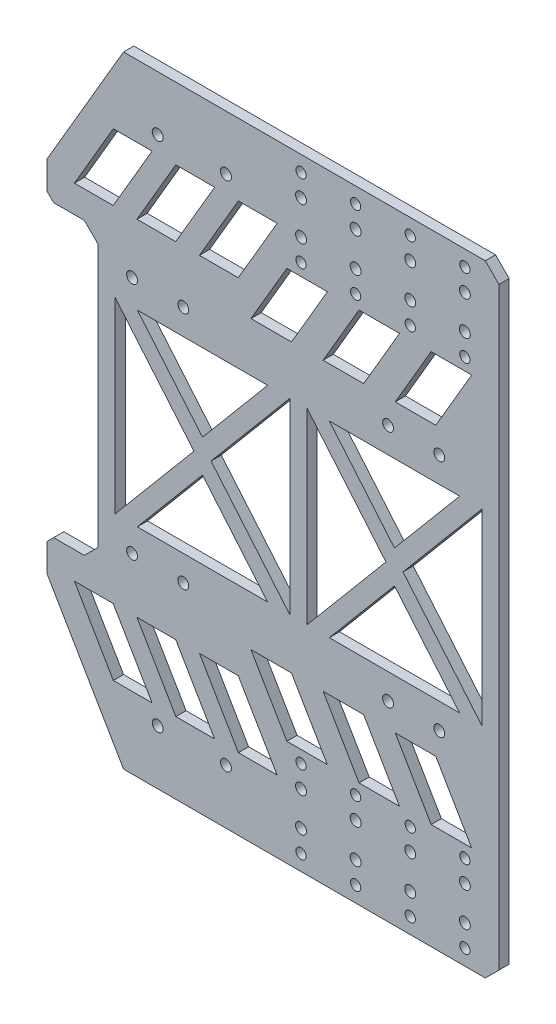
from build123d import *

# Parameters (mm, degrees)
SKETCH_1_W           = 198
SKETCH_1_H           = 182
EXTRUDE_1_DEPTH      = 3
SKETCH_3_R           = 1.6
CUT_EXTRUDE_2_DEPTH  = 3
CUT_EXTRUDE_3_REACH  = 136.503
SKETCH_4_W           = 48
SKETCH_4_H           = 182
SKETCH_5_W           = 40.08977314
SKETCH_5_H           = 112
EXTRUDE_2_DEPTH      = 3
CUT_EXTRUDE_4_REACH  = 168.203
SKETCH_6_R           = 2.75
CUT_EXTRUDE_5_REACH  = 168.203
EXTRUDE_3_DEPTH      = 3
SKETCH_10_R          = 5
CUT_EXTRUDE_6_DEPTH  = 10
SKETCH_11_W          = 64.5
SKETCH_11_H          = 5
SKETCH_11_W_2        = 5
SKETCH_11_H_2        = 27.5973386
SKETCH_11_W_3        = 27.979591052
SKETCH_11_W_4        = 25.900597597
EXTRUDE_1_2_DEPTH    = 3
SKETCH_12_W          = 5
SKETCH_12_H          = 27.589725495
SKETCH_12_H_2        = 28.751885351
SKETCH_12_H_3        = 68.5
EXTRUDE_2_2_DEPTH    = 3
EXTRUDE_3_2_DEPTH    = 3
EXTRUDE_4_DEPTH      = 3
CUT_EXTRUDE_7_REACH  = 168.203
SKETCH_15_R          = 2.75
EXTRUDE_5_DEPTH      = 3
EXTRUDE_6_DEPTH      = 3
CUT_EXTRUDE_8_REACH  = 168.203
SKETCH_18_R          = 2.75
EXTRUDE_7_DEPTH      = 3
CUT_EXTRUDE_9_REACH  = 168.203
SKETCH_20_R          = 2.75
EXTRUDE_8_DEPTH      = 3
CUT_EXTRUDE_10_REACH = 168.203
SKETCH_22_R          = 2.75
EXTRUDE_4_2_DEPTH    = 3
SKETCH_24_W          = 34.702091236
SKETCH_24_H          = 10
EXTRUDE_9_DEPTH      = 3
CUT_EXTRUDE_11_REACH = 168.203
CUT_EXTRUDE_12_REACH = 168.203
SKETCH_26_R          = 2.75
EXTRUDE_5_2_DEPTH    = 3
SKETCH_28_W          = 250
SKETCH_28_H          = 182
SKETCH_28_R          = 1.6
EXTRUDE_6_2_DEPTH    = 3
SKETCH_29_R          = 1.6
CUT_EXTRUDE_13_DEPTH = 219.840124292
SKETCH_30_R          = 1.6
CUT_EXTRUDE_14_DEPTH = 219.840124292
SKETCH_31_OUTSIDE_W  = 313.85
SKETCH_31_OUTSIDE_H  = 245.85
CUT_EXTRUDE_15_DEPTH = 219.840124292
CUT_EXTRUDE_16_DEPTH = 186.397545831
CHAMFER_1_SIZE       = 2
CHAMFER_2_SIZE       = 4
SKETCH_34_R          = 1.5
CUT_EXTRUDE_17_DEPTH = 186.397545831


with BuildPart() as part:
    # 草图1 → Extrude 1 (new body)
    with BuildSketch(Plane.XY):
        Rectangle(SKETCH_1_W, SKETCH_1_H)
    extrude(amount=EXTRUDE_1_DEPTH)

    # 草图3 → 切除-拉伸2 (cut)
    with BuildSketch(Plane(origin=(0, 0, 0), x_dir=(-1, 0, 0), z_dir=(0, 0, -1))):
        with Locations((-39, -80)):
            Circle(SKETCH_3_R)
        with Locations((-39, -70)):
            Circle(SKETCH_3_R)
        with Locations((-23, -80)):
            Circle(SKETCH_3_R)
        with Locations((-23, -70)):
            Circle(SKETCH_3_R)
        with Locations((-7, -80)):
            Circle(SKETCH_3_R)
        with Locations((-7, -70)):
            Circle(SKETCH_3_R)
        with Locations((9, -80)):
            Circle(SKETCH_3_R)
        with Locations((9, -70)):
            Circle(SKETCH_3_R)
        with Locations((87, -80)):
            Circle(SKETCH_3_R)
        with Locations((87, -70)):
            Circle(SKETCH_3_R)
        with Locations((71, -80)):
            Circle(SKETCH_3_R)
        with Locations((71, -70)):
            Circle(SKETCH_3_R)
        with Locations((55, -80)):
            Circle(SKETCH_3_R)
        with Locations((55, -70)):
            Circle(SKETCH_3_R)
        with Locations((39, -80)):
            Circle(SKETCH_3_R)
        with Locations((39, -70)):
            Circle(SKETCH_3_R)
        with Locations((39, 70)):
            Circle(SKETCH_3_R)
        with Locations((39, 80)):
            Circle(SKETCH_3_R)
        with Locations((55, 70)):
            Circle(SKETCH_3_R)
        with Locations((55, 80)):
            Circle(SKETCH_3_R)
        with Locations((71, 70)):
            Circle(SKETCH_3_R)
        with Locations((71, 80)):
            Circle(SKETCH_3_R)
        with Locations((87, 70)):
            Circle(SKETCH_3_R)
        with Locations((87, 80)):
            Circle(SKETCH_3_R)
        with Locations((9, 70)):
            Circle(SKETCH_3_R)
        with Locations((9, 80)):
            Circle(SKETCH_3_R)
        with Locations((-7, 70)):
            Circle(SKETCH_3_R)
        with Locations((-7, 80)):
            Circle(SKETCH_3_R)
        with Locations((-23, 70)):
            Circle(SKETCH_3_R)
        with Locations((-23, 80)):
            Circle(SKETCH_3_R)
        with Locations((-39, 70)):
            Circle(SKETCH_3_R)
        with Locations((-39, 80)):
            Circle(SKETCH_3_R)
    extrude(amount=-CUT_EXTRUDE_2_DEPTH, mode=Mode.SUBTRACT)

    # 草图4 → 切除-拉伸3 (cut, up to next)
    with BuildSketch(Plane(origin=(0, 0, 0), x_dir=(-1, 0, 0), z_dir=(0, 0, -1)), mode=Mode.PRIVATE) as cut_extrude_3_sk1:
        with Locations((-75, 0)):
            Rectangle(SKETCH_4_W, SKETCH_4_H)
    cut_extrude_3_tool1 = extrude(cut_extrude_3_sk1.sketch, amount=-CUT_EXTRUDE_3_REACH, mode=Mode.PRIVATE) & part.part
    add(cut_extrude_3_tool1.solids().sort_by_distance((75, 0, 0))[0], mode=Mode.SUBTRACT)

    # 草图5 → Extrude 2 (add)
    with BuildSketch(Plane.XY.offset(3)):
        with Locations((-119, 0)):
            Rectangle(SKETCH_5_W, SKETCH_5_H)
    extrude(amount=-EXTRUDE_2_DEPTH)

    # 草图6 → 切除-拉伸4 (cut, up to next)
    with BuildSketch(Plane.XY.offset(3), mode=Mode.PRIVATE) as cut_extrude_4_sk1:
        with Locations((13, -37)):
            Circle(SKETCH_6_R)
    cut_extrude_4_tool1 = extrude(cut_extrude_4_sk1.sketch, amount=-CUT_EXTRUDE_4_REACH, mode=Mode.PRIVATE) & part.part
    # 草图6 → 切除-拉伸4 (cut, up to next)
    with BuildSketch(Plane.XY.offset(3), mode=Mode.PRIVATE) as cut_extrude_4_sk2:
        with Locations((13, 37)):
            Circle(SKETCH_6_R)
    cut_extrude_4_tool2 = extrude(cut_extrude_4_sk2.sketch, amount=-CUT_EXTRUDE_4_REACH, mode=Mode.PRIVATE) & part.part
    # 草图6 → 切除-拉伸4 (cut, up to next)
    with BuildSketch(Plane.XY.offset(3), mode=Mode.PRIVATE) as cut_extrude_4_sk3:
        with Locations((-57, 37)):
            Circle(SKETCH_6_R)
    cut_extrude_4_tool3 = extrude(cut_extrude_4_sk3.sketch, amount=-CUT_EXTRUDE_4_REACH, mode=Mode.PRIVATE) & part.part
    # 草图6 → 切除-拉伸4 (cut, up to next)
    with BuildSketch(Plane.XY.offset(3), mode=Mode.PRIVATE) as cut_extrude_4_sk4:
        with Locations((-57, -37)):
            Circle(SKETCH_6_R)
    cut_extrude_4_tool4 = extrude(cut_extrude_4_sk4.sketch, amount=-CUT_EXTRUDE_4_REACH, mode=Mode.PRIVATE) & part.part
    # 草图6 → 切除-拉伸4 (cut, up to next)
    with BuildSketch(Plane.XY.offset(3), mode=Mode.PRIVATE) as cut_extrude_4_sk5:
        with Locations((-127, 37)):
            Circle(SKETCH_6_R)
    cut_extrude_4_tool5 = extrude(cut_extrude_4_sk5.sketch, amount=-CUT_EXTRUDE_4_REACH, mode=Mode.PRIVATE) & part.part
    # 草图6 → 切除-拉伸4 (cut, up to next)
    with BuildSketch(Plane.XY.offset(3), mode=Mode.PRIVATE) as cut_extrude_4_sk6:
        with Locations((-127, -37)):
            Circle(SKETCH_6_R)
    cut_extrude_4_tool6 = extrude(cut_extrude_4_sk6.sketch, amount=-CUT_EXTRUDE_4_REACH, mode=Mode.PRIVATE) & part.part
    add(cut_extrude_4_tool1.solids().sort_by_distance((13, -37, 3))[0], mode=Mode.SUBTRACT)
    add(cut_extrude_4_tool2.solids().sort_by_distance((13, 37, 3))[0], mode=Mode.SUBTRACT)
    add(cut_extrude_4_tool3.solids().sort_by_distance((-57, 37, 3))[0], mode=Mode.SUBTRACT)
    add(cut_extrude_4_tool4.solids().sort_by_distance((-57, -37, 3))[0], mode=Mode.SUBTRACT)
    add(cut_extrude_4_tool5.solids().sort_by_distance((-127, 37, 3))[0], mode=Mode.SUBTRACT)
    add(cut_extrude_4_tool6.solids().sort_by_distance((-127, -37, 3))[0], mode=Mode.SUBTRACT)

    # 草图7 → 切除-拉伸5 (cut, up to next)
    with BuildSketch(Plane.XY.offset(3), mode=Mode.PRIVATE) as cut_extrude_5_sk1:
        Polygon((-29.011221643, -15), (-19.011221643, -25), (25.988778357, -25), (35.988778357, -15), (35.988778357, 15), (25.988778357, 25), (-19.011221643, 25), (-29.011221643, 15), align=None)
    cut_extrude_5_tool1 = extrude(cut_extrude_5_sk1.sketch, amount=-CUT_EXTRUDE_5_REACH, mode=Mode.PRIVATE) & part.part
    # 草图7 → 切除-拉伸5 (cut, up to next)
    with BuildSketch(Plane.XY.offset(3), mode=Mode.PRIVATE) as cut_extrude_5_sk2:
        Polygon((-114.033664928, -25), (-124.033664928, -15), (-124.033664928, 15), (-114.033664928, 25), (-69.033664928, 25), (-59.033664928, 15), (-59.033664928, -15), (-69.033664928, -25), align=None)
    cut_extrude_5_tool2 = extrude(cut_extrude_5_sk2.sketch, amount=-CUT_EXTRUDE_5_REACH, mode=Mode.PRIVATE) & part.part
    add(cut_extrude_5_tool1.solids().sort_by_distance((3.488778, 0, 3))[0], mode=Mode.SUBTRACT)
    add(cut_extrude_5_tool2.solids().sort_by_distance((-91.533665, 0, 3))[0], mode=Mode.SUBTRACT)

    # 草图8 → Extrude 3 (add)
    with BuildSketch(Plane.XY.offset(3)):
        Polygon((-99, -56), (-139.04488657, -56), (-99, -91), align=None)
        Polygon((-139.04488657, 56), (-99, 91), (-99, 56), align=None)
    extrude(amount=-EXTRUDE_3_DEPTH)

    # 草图10 → 切除-拉伸6 (cut)
    # profile 1 of 2: a face of its own
    with BuildSketch(Plane.XY.offset(3)):
        with BuildLine():
            Line((-127, 32), (-127, 0))
            Line((-127, 0), (41, 0))
            Line((41, 0), (41, 66))
            Line((41, 66), (-115.251187, 66))
            Line((-115.251187, 66), (-127, 55.73131178))
            Line((-127, 55.73131178), (-127, 42))
            ThreePointArc((-127, 42), (-123.464466094, 40.535533906), (-122, 37))
            ThreePointArc((-122, 37), (-123.464466094, 33.464466094), (-127, 32))
        make_face()
        with Locations((-57, 37)):
            Circle(SKETCH_10_R, mode=Mode.SUBTRACT)
        with Locations((13, 37)):
            Circle(SKETCH_10_R, mode=Mode.SUBTRACT)
    # profile 2 of 2: a face of its own
    with BuildSketch(Plane.XY.offset(3)):
        with BuildLine():
            Line((41, 0), (-127, 0))
            Line((-127, 0), (-127, -32))
            ThreePointArc((-127, -32), (-122, -37), (-127, -42))
            Line((-127, -42), (-127, -55.73131178))
            Line((-127, -55.73131178), (-115.251187, -66))
            Line((-115.251187, -66), (41, -66))
            Line((41, -66), (41, 0))
        make_face()
        with Locations((-57, -37)):
            Circle(SKETCH_10_R, mode=Mode.SUBTRACT)
        with Locations((13, -37)):
            Circle(SKETCH_10_R, mode=Mode.SUBTRACT)
    extrude(amount=-CUT_EXTRUDE_6_DEPTH, mode=Mode.SUBTRACT)


with BuildPart() as cut_extrude_6_piece_1:
    # of the separate pieces the step leaves, piece 1, a body of its own (cut_extrude_6_pieces)
    add(part.part.solids().sort_by_distance((-99, 91, 0))[0])



with BuildPart() as cut_extrude_6_piece_2:
    # of the separate pieces the step leaves, piece 2, a body of its own (cut_extrude_6_pieces)
    add(part.part.solids().sort_by_distance((18, -37, 0))[0])


with BuildPart() as cut_extrude_6_piece_3:
    # of the separate pieces the step leaves, piece 3, a body of its own (cut_extrude_6_pieces)
    add(part.part.solids().sort_by_distance((18, 37, 0))[0])


with BuildPart() as cut_extrude_6_piece_4:
    # of the separate pieces the step leaves, piece 4, a body of its own (cut_extrude_6_pieces)
    add(part.part.solids().sort_by_distance((-52, -37, 0))[0])


with BuildPart() as cut_extrude_6_piece_5:
    # of the separate pieces the step leaves, piece 5, a body of its own (cut_extrude_6_pieces)
    add(part.part.solids().sort_by_distance((-52, 37, 0))[0])


with BuildPart() as cut_extrude_6_piece_1_1:
    add(cut_extrude_6_piece_1.part)

    add(cut_extrude_6_piece_2.part)  # Extrude 1 2 merges 切除-拉伸6 piece 2

    add(cut_extrude_6_piece_3.part)  # Extrude 1 2 merges 切除-拉伸6 piece 3

    add(cut_extrude_6_piece_4.part)  # Extrude 1 2 merges 切除-拉伸6 piece 4

    add(cut_extrude_6_piece_5.part)  # Extrude 1 2 merges 切除-拉伸6 piece 5
    # 草图11 → Extrude 1 2 (add)
    with BuildSketch(Plane.XY.offset(3)):
        with Locations((-92, -37)):
            Rectangle(SKETCH_11_W, SKETCH_11_H)
        with Locations((-57, -53.5486693)):
            Rectangle(SKETCH_11_W_2, SKETCH_11_H_2)
        with Locations((-22, -37)):
            Rectangle(SKETCH_11_W, SKETCH_11_H)
        with Locations((13, -53.5486693)):
            Rectangle(SKETCH_11_W_2, SKETCH_11_H_2)
        with Locations((-92, 37)):
            Rectangle(SKETCH_11_W, SKETCH_11_H)
        with Locations((29.739795526, -37)):
            Rectangle(SKETCH_11_W_3, SKETCH_11_H)
        with Locations((-22, 37)):
            Rectangle(SKETCH_11_W, SKETCH_11_H)
        with Locations((28.700298799, 37)):
            Rectangle(SKETCH_11_W_4, SKETCH_11_H)
    extrude(amount=-EXTRUDE_1_2_DEPTH)

    # 草图12 → Extrude 2 2 (add)
    with BuildSketch(Plane.XY.offset(3)):
        with Locations((-57, 53.544862748)):
            Rectangle(SKETCH_12_W, SKETCH_12_H)
        with Locations((13, 54.125942675)):
            Rectangle(SKETCH_12_W, SKETCH_12_H_2)
        with Locations((13, 0)):
            Rectangle(SKETCH_12_W, SKETCH_12_H_3)
        with Locations((-57, 0)):
            Rectangle(SKETCH_12_W, SKETCH_12_H_3)
    extrude(amount=-EXTRUDE_2_2_DEPTH)

    # 草图13 → Extrude 3 2 (add)
    with BuildSketch(Plane.XY.offset(3)):
        Polygon((-55.183828958, -38.717999635), (14.816171042, 35.282000365), (11.183828958, 38.717999635), (-58.816171042, -35.282000365), align=None)
        Polygon((-56.066765691, 34.68071698), (-55.454393219, 34.927123735), (-57.320861836, 39.565689774), (-57.933234309, 39.31928302), align=None)
    extrude(amount=-EXTRUDE_3_2_DEPTH)


with BuildPart() as extrude_3_2_piece_1:
    # of the separate pieces the step leaves, piece 1, a body of its own (extrude_3_2_pieces)
    add(cut_extrude_6_piece_1_1.part.solids().sort_by_distance((51, -91, 0))[0])



with BuildPart() as extrude_3_2_piece_2:
    # of the separate pieces the step leaves, piece 2, a body of its own (extrude_3_2_pieces)
    add(cut_extrude_6_piece_1_1.part.solids().sort_by_distance((-56.066765691, 34.68071698, 3))[0])


with BuildPart() as extrude_3_2_piece_1_1:
    add(extrude_3_2_piece_1.part)

    add(extrude_3_2_piece_2.part)  # Extrude 4 merges Extrude 3 2 piece 2
    # 草图14 → Extrude 4 (add)
    with BuildSketch(Plane(origin=(0, 0, 0), x_dir=(-1, 0, 0), z_dir=(0, 0, -1))):
        Polygon((55.183828958, 38.717999635), (-14.816171042, -35.282000365), (-11.183828958, -38.717999635), (58.816171042, 35.282000365), align=None)
    extrude(amount=-EXTRUDE_4_DEPTH)

    # 草图15 → 切除-拉伸7 (cut, up to next)
    with BuildSketch(Plane.XY.offset(3), mode=Mode.PRIVATE) as cut_extrude_7_sk1:
        with Locations((-57, -37)):
            Circle(SKETCH_15_R)
    cut_extrude_7_tool1 = extrude(cut_extrude_7_sk1.sketch, amount=-CUT_EXTRUDE_7_REACH, mode=Mode.PRIVATE) & extrude_3_2_piece_1_1.part
    # 草图15 → 切除-拉伸7 (cut, up to next)
    with BuildSketch(Plane.XY.offset(3), mode=Mode.PRIVATE) as cut_extrude_7_sk2:
        with Locations((-57, 37)):
            Circle(SKETCH_15_R)
    cut_extrude_7_tool2 = extrude(cut_extrude_7_sk2.sketch, amount=-CUT_EXTRUDE_7_REACH, mode=Mode.PRIVATE) & extrude_3_2_piece_1_1.part
    # 草图15 → 切除-拉伸7 (cut, up to next)
    with BuildSketch(Plane.XY.offset(3), mode=Mode.PRIVATE) as cut_extrude_7_sk3:
        with Locations((13, 37)):
            Circle(SKETCH_15_R)
    cut_extrude_7_tool3 = extrude(cut_extrude_7_sk3.sketch, amount=-CUT_EXTRUDE_7_REACH, mode=Mode.PRIVATE) & extrude_3_2_piece_1_1.part
    # 草图15 → 切除-拉伸7 (cut, up to next)
    with BuildSketch(Plane.XY.offset(3), mode=Mode.PRIVATE) as cut_extrude_7_sk4:
        with Locations((13, -37)):
            Circle(SKETCH_15_R)
    cut_extrude_7_tool4 = extrude(cut_extrude_7_sk4.sketch, amount=-CUT_EXTRUDE_7_REACH, mode=Mode.PRIVATE) & extrude_3_2_piece_1_1.part
    add(cut_extrude_7_tool1.solids().sort_by_distance((-57, -37, 3))[0], mode=Mode.SUBTRACT)
    add(cut_extrude_7_tool2.solids().sort_by_distance((-57, 37, 3))[0], mode=Mode.SUBTRACT)
    add(cut_extrude_7_tool3.solids().sort_by_distance((13, 37, 3))[0], mode=Mode.SUBTRACT)
    add(cut_extrude_7_tool4.solids().sort_by_distance((13, -37, 3))[0], mode=Mode.SUBTRACT)

    # 草图16 → Extrude 5 (add)
    with BuildSketch(Plane.XY.offset(3)):
        Polygon((-55.183828958, -35.282000365), (-125.183828958, 38.717999635), (-128.816171042, 35.282000365), (-58.816171042, -38.717999635), align=None)
        Polygon((-58.816171042, 38.717999635), (-128.816171042, -35.282000365), (-125.183828958, -38.717999635), (-55.183828958, 35.282000365), align=None)
    extrude(amount=-EXTRUDE_5_DEPTH)

    # 草图17 → Extrude 6 (add)
    with BuildSketch(Plane.XY.offset(3)):
        Polygon((38.67213331, 35.41161213), (10.67213331, -36.08838787), (15.32786669, -37.91161213), (43.32786669, 33.58838787), align=None)
        Polygon((10.67213331, 36.08838787), (38.67213331, -35.41161213), (43.32786669, -33.58838787), (15.32786669, 37.91161213), align=None)
    extrude(amount=-EXTRUDE_6_DEPTH)

    # 草图18 → 切除-拉伸8 (cut, up to next)
    with BuildSketch(Plane(origin=(0, 0, 0), x_dir=(-1, 0, 0), z_dir=(0, 0, -1)), mode=Mode.PRIVATE) as cut_extrude_8_sk1:
        with Locations(Location((-13, -37, 0), (0, 0, 180))):
            Circle(SKETCH_18_R)
    cut_extrude_8_tool1 = extrude(cut_extrude_8_sk1.sketch, amount=-CUT_EXTRUDE_8_REACH, mode=Mode.PRIVATE) & extrude_3_2_piece_1_1.part
    # 草图18 → 切除-拉伸8 (cut, up to next)
    with BuildSketch(Plane(origin=(0, 0, 0), x_dir=(-1, 0, 0), z_dir=(0, 0, -1)), mode=Mode.PRIVATE) as cut_extrude_8_sk2:
        with Locations(Location((-13, 37, 0), (0, 0, 180))):
            Circle(SKETCH_18_R)
    cut_extrude_8_tool2 = extrude(cut_extrude_8_sk2.sketch, amount=-CUT_EXTRUDE_8_REACH, mode=Mode.PRIVATE) & extrude_3_2_piece_1_1.part
    # 草图18 → 切除-拉伸8 (cut, up to next)
    with BuildSketch(Plane(origin=(0, 0, 0), x_dir=(-1, 0, 0), z_dir=(0, 0, -1)), mode=Mode.PRIVATE) as cut_extrude_8_sk3:
        with Locations(Location((57, 37, 0), (0, 0, 180))):
            Circle(SKETCH_18_R)
    cut_extrude_8_tool3 = extrude(cut_extrude_8_sk3.sketch, amount=-CUT_EXTRUDE_8_REACH, mode=Mode.PRIVATE) & extrude_3_2_piece_1_1.part
    # 草图18 → 切除-拉伸8 (cut, up to next)
    with BuildSketch(Plane(origin=(0, 0, 0), x_dir=(-1, 0, 0), z_dir=(0, 0, -1)), mode=Mode.PRIVATE) as cut_extrude_8_sk4:
        with Locations(Location((57, -37, 0), (0, 0, 180))):
            Circle(SKETCH_18_R)
    cut_extrude_8_tool4 = extrude(cut_extrude_8_sk4.sketch, amount=-CUT_EXTRUDE_8_REACH, mode=Mode.PRIVATE) & extrude_3_2_piece_1_1.part
    # 草图18 → 切除-拉伸8 (cut, up to next)
    with BuildSketch(Plane(origin=(0, 0, 0), x_dir=(-1, 0, 0), z_dir=(0, 0, -1)), mode=Mode.PRIVATE) as cut_extrude_8_sk5:
        with Locations(Location((127, -37, 0), (0, 0, 180))):
            Circle(SKETCH_18_R)
    cut_extrude_8_tool5 = extrude(cut_extrude_8_sk5.sketch, amount=-CUT_EXTRUDE_8_REACH, mode=Mode.PRIVATE) & extrude_3_2_piece_1_1.part
    # 草图18 → 切除-拉伸8 (cut, up to next)
    with BuildSketch(Plane(origin=(0, 0, 0), x_dir=(-1, 0, 0), z_dir=(0, 0, -1)), mode=Mode.PRIVATE) as cut_extrude_8_sk6:
        with Locations(Location((127, 37, 0), (0, 0, 180))):
            Circle(SKETCH_18_R)
    cut_extrude_8_tool6 = extrude(cut_extrude_8_sk6.sketch, amount=-CUT_EXTRUDE_8_REACH, mode=Mode.PRIVATE) & extrude_3_2_piece_1_1.part
    add(cut_extrude_8_tool1.solids().sort_by_distance((13, -37, 0))[0], mode=Mode.SUBTRACT)
    add(cut_extrude_8_tool2.solids().sort_by_distance((13, 37, 0))[0], mode=Mode.SUBTRACT)
    add(cut_extrude_8_tool3.solids().sort_by_distance((-57, 37, 0))[0], mode=Mode.SUBTRACT)
    add(cut_extrude_8_tool4.solids().sort_by_distance((-57, -37, 0))[0], mode=Mode.SUBTRACT)
    add(cut_extrude_8_tool5.solids().sort_by_distance((-127, -37, 0))[0], mode=Mode.SUBTRACT)
    add(cut_extrude_8_tool6.solids().sort_by_distance((-127, 37, 0))[0], mode=Mode.SUBTRACT)

    # 草图19 → 拉伸-薄壁7 (add)
    with BuildSketch(Plane.XY.offset(3)):
        Polygon((-116.365359108, 63.762005247), (-57.077324478, 34.245816946), (11.486851349, 63.703018412), (9.513148651, 68.296981588), (-56.922675522, 39.754183054), (-114.137014892, 68.237994753), align=None)
        Polygon((39.201496348, 67.736486284), (12.400645792, 39.978462494), (-53.513148651, 68.296981588), (-55.486851349, 63.703018412), (13.599354208, 34.021537506), (42.798503652, 64.263513716), align=None)
        Polygon((-126.013148651, 34.703018412), (-58.513148651, 63.703018412), (-60.486851349, 68.296981588), (-127.986851349, 39.296981588), align=None)
        Polygon((13.698570602, 64.26654907), (39.198570602, 37.76654907), (42.801429398, 41.23345093), (17.301429398, 67.73345093), align=None)
    extrude(amount=-EXTRUDE_7_DEPTH)

    # 草图20 → 切除-拉伸9 (cut, up to next)
    with BuildSketch(Plane(origin=(0, 0, 0), x_dir=(-1, 0, 0), z_dir=(0, 0, -1)), mode=Mode.PRIVATE) as cut_extrude_9_sk1:
        with Locations(Location((-13, 37, 0), (0, 0, 180))):
            Circle(SKETCH_20_R)
    cut_extrude_9_tool1 = extrude(cut_extrude_9_sk1.sketch, amount=-CUT_EXTRUDE_9_REACH, mode=Mode.PRIVATE) & extrude_3_2_piece_1_1.part
    # 草图20 → 切除-拉伸9 (cut, up to next)
    with BuildSketch(Plane(origin=(0, 0, 0), x_dir=(-1, 0, 0), z_dir=(0, 0, -1)), mode=Mode.PRIVATE) as cut_extrude_9_sk2:
        with Locations(Location((57, 37, 0), (0, 0, 180))):
            Circle(SKETCH_20_R)
    cut_extrude_9_tool2 = extrude(cut_extrude_9_sk2.sketch, amount=-CUT_EXTRUDE_9_REACH, mode=Mode.PRIVATE) & extrude_3_2_piece_1_1.part
    # 草图20 → 切除-拉伸9 (cut, up to next)
    with BuildSketch(Plane(origin=(0, 0, 0), x_dir=(-1, 0, 0), z_dir=(0, 0, -1)), mode=Mode.PRIVATE) as cut_extrude_9_sk3:
        with Locations(Location((127, 37, 0), (0, 0, 180))):
            Circle(SKETCH_20_R)
    cut_extrude_9_tool3 = extrude(cut_extrude_9_sk3.sketch, amount=-CUT_EXTRUDE_9_REACH, mode=Mode.PRIVATE) & extrude_3_2_piece_1_1.part
    add(cut_extrude_9_tool1.solids().sort_by_distance((13, 37, 0))[0], mode=Mode.SUBTRACT)
    add(cut_extrude_9_tool2.solids().sort_by_distance((-57, 37, 0))[0], mode=Mode.SUBTRACT)
    add(cut_extrude_9_tool3.solids().sort_by_distance((-127, 37, 0))[0], mode=Mode.SUBTRACT)

    # 草图21 → 拉伸-薄壁8 (add)
    with BuildSketch(Plane(origin=(0, 0, 0), x_dir=(-1, 0, 0), z_dir=(0, 0, -1))):
        Polygon((55.486851349, -63.703018412), (-13.599354208, -34.021537506), (-42.798503652, -64.263513716), (-39.201496348, -67.736486284), (-12.400645792, -39.978462494), (53.513148651, -68.296981588), align=None)
        Polygon((-13.698570602, -64.26654907), (-39.198570602, -37.76654907), (-42.801429398, -41.23345093), (-17.301429398, -67.73345093), align=None)
        Polygon((-9.513148651, -68.296981588), (56.922675522, -39.754183054), (114.137014892, -68.237994753), (116.365359108, -63.762005247), (57.077324478, -34.245816946), (-11.486851349, -63.703018412), align=None)
        Polygon((60.486851349, -68.296981588), (127.986851349, -39.296981588), (126.013148651, -34.703018412), (58.513148651, -63.703018412), align=None)
    extrude(amount=-EXTRUDE_8_DEPTH)

    # 草图22 → 切除-拉伸10 (cut, up to next)
    with BuildSketch(Plane.XY.offset(3), mode=Mode.PRIVATE) as cut_extrude_10_sk1:
        with Locations((-127, -37)):
            Circle(SKETCH_22_R)
    cut_extrude_10_tool1 = extrude(cut_extrude_10_sk1.sketch, amount=-CUT_EXTRUDE_10_REACH, mode=Mode.PRIVATE) & extrude_3_2_piece_1_1.part
    # 草图22 → 切除-拉伸10 (cut, up to next)
    with BuildSketch(Plane.XY.offset(3), mode=Mode.PRIVATE) as cut_extrude_10_sk2:
        with Locations((-57, -37)):
            Circle(SKETCH_22_R)
    cut_extrude_10_tool2 = extrude(cut_extrude_10_sk2.sketch, amount=-CUT_EXTRUDE_10_REACH, mode=Mode.PRIVATE) & extrude_3_2_piece_1_1.part
    # 草图22 → 切除-拉伸10 (cut, up to next)
    with BuildSketch(Plane.XY.offset(3), mode=Mode.PRIVATE) as cut_extrude_10_sk3:
        with Locations((13, -37)):
            Circle(SKETCH_22_R)
    cut_extrude_10_tool3 = extrude(cut_extrude_10_sk3.sketch, amount=-CUT_EXTRUDE_10_REACH, mode=Mode.PRIVATE) & extrude_3_2_piece_1_1.part
    add(cut_extrude_10_tool1.solids().sort_by_distance((-127, -37, 3))[0], mode=Mode.SUBTRACT)
    add(cut_extrude_10_tool2.solids().sort_by_distance((-57, -37, 3))[0], mode=Mode.SUBTRACT)
    add(cut_extrude_10_tool3.solids().sort_by_distance((13, -37, 3))[0], mode=Mode.SUBTRACT)

    # 草图23 → Extrude 4 2 (add)
    with BuildSketch(Plane.XY.offset(3)):
        Polygon((-115.251187, 66), (-116.365359108, 63.762005247), (-117.286870077, 64.220773892), align=None)
        Polygon((-116.365359108, -63.762005247), (-117.286870077, -64.220773892), (-115.251187, -66), align=None)
    extrude(amount=-EXTRUDE_4_2_DEPTH)

    # 草图24 → 拉伸-薄壁9 (add)
    with BuildSketch(Plane(origin=(0, 0, 0), x_dir=(-1, 0, 0), z_dir=(0, 0, -1))):
        with Locations((4.595499259, 0)):
            Rectangle(SKETCH_24_W, SKETCH_24_H)
    extrude(amount=-EXTRUDE_9_DEPTH)

    # 草图25 → 切除-拉伸11 (cut, up to next)
    with BuildSketch(Plane(origin=(0, 0, 0), x_dir=(-1, 0, 0), z_dir=(0, 0, -1)), mode=Mode.PRIVATE) as cut_extrude_11_sk1:
        Polygon((20.711576102, 5), (21.946544877, 3.694461581), (21.946544877, 5), align=None)
    cut_extrude_11_tool1 = extrude(cut_extrude_11_sk1.sketch, amount=-CUT_EXTRUDE_11_REACH, mode=Mode.PRIVATE) & extrude_3_2_piece_1_1.part
    # 草图25 → 切除-拉伸11 (cut, up to next)
    with BuildSketch(Plane(origin=(0, 0, 0), x_dir=(-1, 0, 0), z_dir=(0, 0, -1)), mode=Mode.PRIVATE) as cut_extrude_11_sk2:
        Polygon((20.711576102, -5), (21.946544877, -5), (21.946544877, -3.694461581), align=None)
    cut_extrude_11_tool2 = extrude(cut_extrude_11_sk2.sketch, amount=-CUT_EXTRUDE_11_REACH, mode=Mode.PRIVATE) & extrude_3_2_piece_1_1.part
    add(cut_extrude_11_tool1.solids().sort_by_distance((-21.534889, 4.564821, 0))[0], mode=Mode.SUBTRACT)
    add(cut_extrude_11_tool2.solids().sort_by_distance((-21.534889, -4.564821, 0))[0], mode=Mode.SUBTRACT)

    # 草图26 → 切除-拉伸12 (cut, up to next)
    with BuildSketch(Plane(origin=(0, 0, 0), x_dir=(-1, 0, 0), z_dir=(0, 0, -1)), mode=Mode.PRIVATE) as cut_extrude_12_sk1:
        with Locations((7, 0)):
            Circle(SKETCH_26_R)
    cut_extrude_12_tool1 = extrude(cut_extrude_12_sk1.sketch, amount=-CUT_EXTRUDE_12_REACH, mode=Mode.PRIVATE) & extrude_3_2_piece_1_1.part
    add(cut_extrude_12_tool1.solids().sort_by_distance((-7, 0, 0))[0], mode=Mode.SUBTRACT)

    # 草图27 → Extrude 5 2 (add)
    with BuildSketch(Plane.XY.offset(3)):
        Polygon((10.5, 5), (-2.339765735, 17.145724344), (-13.828964438, 5), align=None)
        Polygon((-13.828964438, -5), (10.5, -5), (-2.339765735, -17.145724344), align=None)
    extrude(amount=-EXTRUDE_5_2_DEPTH)

    # 草图28 → Extrude 6 2 (add)
    with BuildSketch(Plane.XY.offset(3)):
        with Locations((-74, 0)):
            Rectangle(SKETCH_28_W, SKETCH_28_H)
        with Locations(Location((-87, -70, 0), (0, 0, 180))):
            Circle(SKETCH_28_R, mode=Mode.SUBTRACT)
        with Locations(Location((-87, -80, 0), (0, 0, 180))):
            Circle(SKETCH_28_R, mode=Mode.SUBTRACT)
        with Locations(Location((-71, -70, 0), (0, 0, 180))):
            Circle(SKETCH_28_R, mode=Mode.SUBTRACT)
        with Locations(Location((-71, -80, 0), (0, 0, 180))):
            Circle(SKETCH_28_R, mode=Mode.SUBTRACT)
        with Locations(Location((-55, -70, 0), (0, 0, 180))):
            Circle(SKETCH_28_R, mode=Mode.SUBTRACT)
        with Locations(Location((-55, -80, 0), (0, 0, 180))):
            Circle(SKETCH_28_R, mode=Mode.SUBTRACT)
        with Locations(Location((-39, -70, 0), (0, 0, 180))):
            Circle(SKETCH_28_R, mode=Mode.SUBTRACT)
        with Locations(Location((-39, -80, 0), (0, 0, 180))):
            Circle(SKETCH_28_R, mode=Mode.SUBTRACT)
        with Locations(Location((-87, 80, 0), (0, 0, 180))):
            Circle(SKETCH_28_R, mode=Mode.SUBTRACT)
        with Locations(Location((-87, 70, 0), (0, 0, 180))):
            Circle(SKETCH_28_R, mode=Mode.SUBTRACT)
        with Locations(Location((-71, 80, 0), (0, 0, 180))):
            Circle(SKETCH_28_R, mode=Mode.SUBTRACT)
        with Locations(Location((-71, 70, 0), (0, 0, 180))):
            Circle(SKETCH_28_R, mode=Mode.SUBTRACT)
        with Locations(Location((-55, 80, 0), (0, 0, 180))):
            Circle(SKETCH_28_R, mode=Mode.SUBTRACT)
        with Locations(Location((-55, 70, 0), (0, 0, 180))):
            Circle(SKETCH_28_R, mode=Mode.SUBTRACT)
        with Locations(Location((-39, 80, 0), (0, 0, 180))):
            Circle(SKETCH_28_R, mode=Mode.SUBTRACT)
        with Locations(Location((-39, 70, 0), (0, 0, 180))):
            Circle(SKETCH_28_R, mode=Mode.SUBTRACT)
    extrude(amount=-EXTRUDE_6_2_DEPTH)

    # 草图29 → 切除-拉伸13 (cut, through all)
    with BuildSketch(Plane.XY.offset(3)):
        with Locations((-129, 75)):
            Circle(SKETCH_29_R)
        with Locations((-109, 75)):
            Circle(SKETCH_29_R)
        with Locations(Location((-109, -75, 0), (0, 0, 180))):
            Circle(SKETCH_29_R)
        with Locations(Location((-129, -75, 0), (0, 0, 180))):
            Circle(SKETCH_29_R)
    extrude(amount=-CUT_EXTRUDE_13_DEPTH, mode=Mode.SUBTRACT)

    # 草图30 → 切除-拉伸14 (cut, through all)
    with BuildSketch(Plane.XY.offset(3)):
        with Locations((-136.5, 35)):
            Circle(SKETCH_30_R)
        with Locations((-121.5, 35)):
            Circle(SKETCH_30_R)
        with Locations(Location((-121.5, -35, 0), (0, 0, 180))):
            Circle(SKETCH_30_R)
        with Locations(Location((-136.5, -35, 0), (0, 0, 180))):
            Circle(SKETCH_30_R)
        with Locations((-46.5, -35)):
            Circle(SKETCH_30_R)
        with Locations((-61.5, -35)):
            Circle(SKETCH_30_R)
        with Locations(Location((-61.5, 35, 0), (0, 0, 180))):
            Circle(SKETCH_30_R)
        with Locations(Location((-46.5, 35, 0), (0, 0, 180))):
            Circle(SKETCH_30_R)
    extrude(amount=-CUT_EXTRUDE_14_DEPTH, mode=Mode.SUBTRACT)

    # 草图31 outside → 切除-拉伸15 (cut, through all)
    with BuildSketch(Plane.XY.offset(3)):
        with Locations((-74, 0)):
            Rectangle(SKETCH_31_OUTSIDE_W, SKETCH_31_OUTSIDE_H)
        Polygon((-146.5, -42.5), (-146.5, 42.5), (-161.5, 42.5), (-161.5, 52.5), (-139, 91), (-29, 91), (-29, -91), (-139, -91), (-161.5, -52.5), (-161.5, -42.5), align=None, mode=Mode.SUBTRACT)
    extrude(amount=-CUT_EXTRUDE_15_DEPTH, mode=Mode.SUBTRACT)

    # 草图32 → 切除-拉伸16 (cut, through all)
    with BuildSketch(Plane.XY.offset(3)):
        Polygon((-134.967144386, 27.5), (-96.782855614, 27.5), (-115.875, 4.795828298), align=None)
        Polygon((-141.5, 27.5), (-141.5, -27.5), (-118.375, 0), align=None)
        Polygon((-134.967144386, -27.5), (-96.782855614, -27.5), (-115.875, -4.795828298), align=None)
        Polygon((-90.25, 27.5), (-90.25, -27.5), (-113.375, 0), align=None)
        Polygon((-85.25, 27.5), (-85.25, -27.5), (-62.125, 0), align=None)
        Polygon((-40.532855614, -27.5), (-78.717144386, -27.5), (-59.625, -4.795828298), align=None)
        Polygon((-34, 27.5), (-34, -27.5), (-57.125, 0), align=None)
        Polygon((-40.532855614, 27.5), (-78.717144386, 27.5), (-59.625, 4.795828298), align=None)
        Polygon((-153.402836305, 50.5), (-142.033589601, 50.5), (-130.637485704, 70), (-142.006732409, 70), align=None)
        Polygon((-135.084093453, 50.5), (-123.714846748, 50.5), (-112.318742852, 70), (-123.687989556, 70), align=None)
        Polygon((-116.7653506, 50.5), (-105.396103896, 50.5), (-94, 70), (-105.369246704, 70), align=None)
        Polygon((-101.676766179, 42), (-89.801667535, 42), (-79.282187015, 60), (-91.157285659, 60), align=None)
        Polygon((-80.535672671, 42), (-70.016192151, 60), (-58.141093508, 60), (-68.660574027, 42), align=None)
        Polygon((-59.394579163, 42), (-48.875098644, 60), (-37, 60), (-47.519480519, 42), align=None)
        Polygon((-59.394579163, -42), (-47.519480519, -42), (-37, -60), (-48.875098644, -60), align=None)
        Polygon((-80.535672671, -42), (-68.660574027, -42), (-58.141093508, -60), (-70.016192151, -60), align=None)
        Polygon((-91.157285659, -60), (-79.282187015, -60), (-89.801667535, -42), (-101.676766179, -42), align=None)
        Polygon((-105.369246704, -70), (-94, -70), (-105.396103896, -50.5), (-116.7653506, -50.5), align=None)
        Polygon((-123.687989556, -70), (-112.318742852, -70), (-123.714846748, -50.5), (-135.084093453, -50.5), align=None)
        Polygon((-142.006732409, -70), (-130.637485704, -70), (-142.033589601, -50.5), (-153.402836305, -50.5), align=None)
    extrude(amount=-CUT_EXTRUDE_16_DEPTH, mode=Mode.SUBTRACT)

    # 倒角1
    chamfer_1_edges = [extrude_3_2_piece_1_1.edges().sort_by_distance(p)[0] for p in [
        (-161.5, 42.5, 1.5),
        (-161.5, -42.5, 1.5),
    ]]
    chamfer(chamfer_1_edges, length=CHAMFER_1_SIZE)

    # 倒角2
    chamfer_2_edges = [extrude_3_2_piece_1_1.edges().sort_by_distance(p)[0] for p in [
        (-29, 91, 1.5),
        (-29, -91, 1.5),
        (-146.5, -42.5, 1.5),
        (-146.5, 42.5, 1.5),
    ]]
    chamfer(chamfer_2_edges, length=CHAMFER_2_SIZE)

    # 草图34 → 切除-拉伸17 (cut, through all)
    with BuildSketch(Plane(origin=(0, 0, 0), x_dir=(-1, 0, 0), z_dir=(0, 0, -1))):
        with Locations((71, -86.4)):
            Circle(SKETCH_34_R)
        with Locations((55, -86.4)):
            Circle(SKETCH_34_R)
        with Locations((39, -86.4)):
            Circle(SKETCH_34_R)
        with Locations((87, -86.4)):
            Circle(SKETCH_34_R)
        with Locations((87, -63.6)):
            Circle(SKETCH_34_R)
        with Locations((71, -63.6)):
            Circle(SKETCH_34_R)
        with Locations((55, -63.6)):
            Circle(SKETCH_34_R)
        with Locations((39, -63.6)):
            Circle(SKETCH_34_R)
        with Locations(Location((39, 63.6, 0), (0, 0, 180))):
            Circle(SKETCH_34_R)
        with Locations(Location((55, 63.6, 0), (0, 0, 180))):
            Circle(SKETCH_34_R)
        with Locations(Location((71, 63.6, 0), (0, 0, 180))):
            Circle(SKETCH_34_R)
        with Locations(Location((87, 63.6, 0), (0, 0, 180))):
            Circle(SKETCH_34_R)
        with Locations(Location((87, 86.4, 0), (0, 0, 180))):
            Circle(SKETCH_34_R)
        with Locations(Location((39, 86.4, 0), (0, 0, 180))):
            Circle(SKETCH_34_R)
        with Locations(Location((55, 86.4, 0), (0, 0, 180))):
            Circle(SKETCH_34_R)
        with Locations(Location((71, 86.4, 0), (0, 0, 180))):
            Circle(SKETCH_34_R)
    extrude(amount=-CUT_EXTRUDE_17_DEPTH, mode=Mode.SUBTRACT)


solid = extrude_3_2_piece_1_1.part
